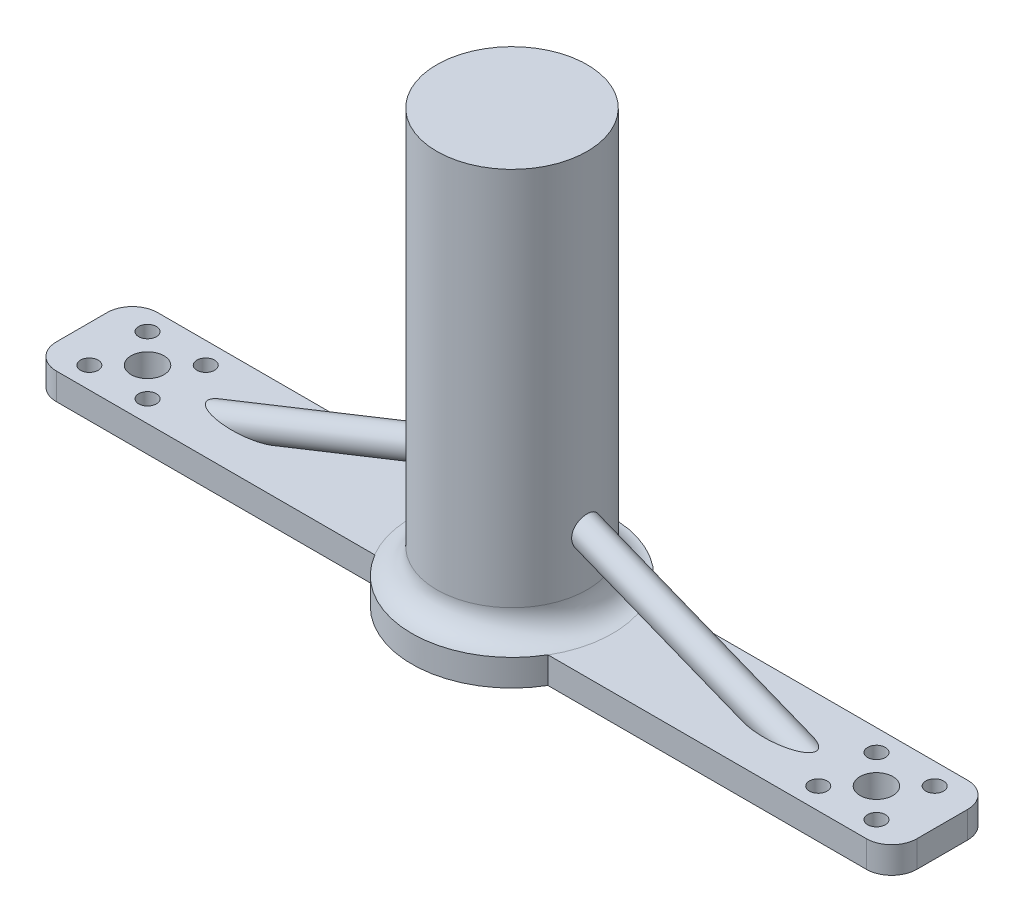
from build123d import *

# Parameters (mm, degrees)
BOSS_EXTRUDE1_DEPTH = 5.25
SKETCH3_R           = 14.850000000000001
BOSS_EXTRUDE2_DEPTH = 80
SKETCH2_R           = 1.749999999999997
SKETCH2_R_2         = 3.250000000000007
CUT_EXTRUDE1_DEPTH  = 119.39358090707452
FILLET8_R           = 5
FILLET9_R           = 5


with BuildPart() as part:
    # Sketch1 → Boss-Extrude1 (new body)
    with BuildSketch(Plane(origin=(0, 0, 0), x_dir=(1, 0, 0), z_dir=(0, 1, 0))):
        with BuildLine():
            Line((-85, -10.000000000000002), (-17.089177862027185, -10))
            ThreePointArc((-17.089177862027185, -10), (1.11e-15, -19.8), (17.089177862027185, -10))
            Line((17.089177862027185, -10), (85, -10.000000000000002))
            Line((85, -10.000000000000002), (85, 10))
            Line((85, 10), (17.089177862027185, 10))
            ThreePointArc((17.089177862027185, 10), (1.11e-15, 19.8), (-17.089177862027185, 10))
            Line((-17.089177862027185, 10), (-85, 10))
            Line((-85, 10), (-85, -10.000000000000002))
        make_face()
    extrude(amount=BOSS_EXTRUDE1_DEPTH)

    # Sketch3 → Boss-Extrude2 (add)
    with BuildSketch(Plane(origin=(0, 5.25, 0), x_dir=(1, 0, 0), z_dir=(0, 1, 0))):
        with Locations(Location((0, 0, 0), (0, 0, 270))):
            Circle(SKETCH3_R)
    extrude(amount=BOSS_EXTRUDE2_DEPTH)

    # Sketch2 → Cut-Extrude1 (cut, through all)
    with BuildSketch(Plane(origin=(0, 5.25, 0), x_dir=(1, 0, 0), z_dir=(0, 1, 0))):
        with Locations(Location((-77.75, 5.7499999999999964, 0), (0, 0, 270))):
            Circle(SKETCH2_R)
        with Locations(Location((-66.25, 5.7499999999999964, 0), (0, 0, 270))):
            Circle(SKETCH2_R)
        with Locations(Location((-66.25, -5.75, 0), (0, 0, 270))):
            Circle(SKETCH2_R)
        with Locations(Location((-77.75, -5.75, 0), (0, 0, 270))):
            Circle(SKETCH2_R)
        with Locations(Location((77.75, -5.75, 0), (0, 0, 270))):
            Circle(SKETCH2_R)
        with Locations(Location((66.25, -5.75, 0), (0, 0, 270))):
            Circle(SKETCH2_R)
        with Locations(Location((77.75, 5.7499999999999964, 0), (0, 0, 270))):
            Circle(SKETCH2_R)
        with Locations(Location((66.25, 5.7499999999999964, 0), (0, 0, 270))):
            Circle(SKETCH2_R)
        with Locations(Location((-72, -2.87e-15, 0), (0, 0, 270))):
            Circle(SKETCH2_R_2)
        with Locations(Location((72, -2.87e-15, 0), (0, 0, 270))):
            Circle(SKETCH2_R_2)
    extrude(amount=-CUT_EXTRUDE1_DEPTH, mode=Mode.SUBTRACT)

    # Sketch5 one side → Revolve1 (revolve)
    with BuildSketch(Plane.XY, mode=Mode.PRIVATE) as revolve1_sk:
        Polygon((-14.850000000000001, 20.23639427704437), (-14.850000000000001, 23.25), (-60.077367189450115, 5.2500000000000036), (-59.041984669000975, 2.648465253672675), align=None)
    revolve1 = revolve(revolve1_sk.sketch.rotate(Axis((-59.041984669000975, 2.648465253672677, 0), (0.9291195522597585, 0.3697794715889807, 0)), 180), axis=Axis((-59.041984669000975, 2.648465253672677, 0), (0.9291195522597585, 0.3697794715889807, 0)))

    # Fillet8
    fillet8_edges = [part.edges().sort_by_distance(p)[0] for p in [
        (85, 2.625, -10),
        (85, 2.625, 10.000000000000002),
        (-85, 2.625, 10.000000000000002),
        (-85, 2.625, -10),
    ]]
    fillet(fillet8_edges, radius=FILLET8_R)

    # Mirror1: Revolve1 across plane
    add(revolve1.mirror(Plane.ZY))

    # Fillet9
    # the kernel refuses this fillet: 5 mm, written as the material it adds along each edge
    with BuildSketch(Plane(origin=(0, 5.25, 0), x_dir=(-1.8e-16, 0, 1), z_dir=(-1, 0, -1.8e-16))) as fillet9_piece_1:
        with BuildLine():
            CenterArc((19.85, 4.99974999375026), FILLET9_R, 180, 89.42703265514302)
            Line((14.850000000000001, 4.99974999375026), (14.750000000000002, 4.99974999375026))
            Line((14.750000000000002, 4.99974999375026), (14.750000000000002, 0))
            Line((14.750000000000002, 0), (14.850000000000001, -0.09999999999999964))
            ThreePointArc((14.850000000000001, -0.09999999999999964), (17.32500000000001, -0.09999999999999964), (19.799000000000017, -0.09999499987442118))
            Line((19.799000000000017, -0.09999499987442118), (19.80000000000002, 5.7288e-13))
        make_face()
    revolve(axis=Axis((0, 5.25, 0), (0, 1, 0)))


solid = part.part
